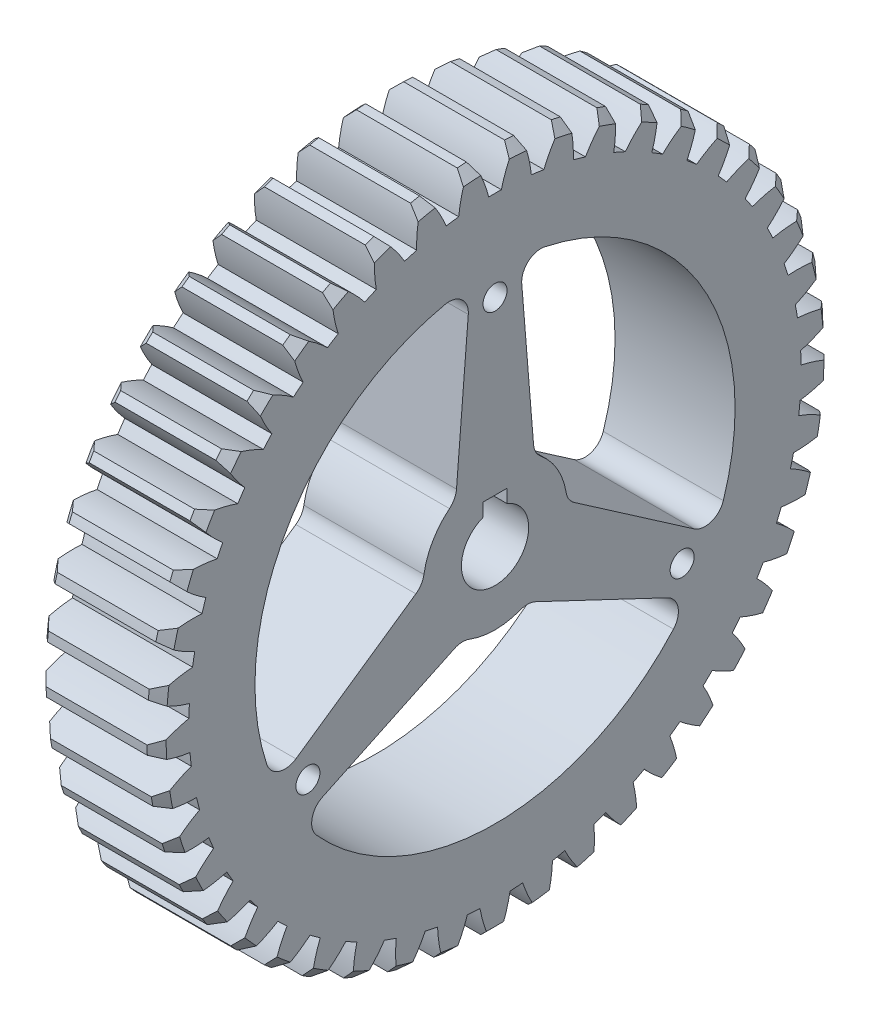
from build123d import *

# Parameters (mm, degrees)
BASPROSKE_W         = 25
BASPROSKE_H         = 70.5
CHAMFER_1_SIZE      = 2
TOOTHCUT_DEPTH      = 103.788618047
TEETHCUTS_COUNT     = 45
TEETHCUTS_ANGLE     = 352
BORSKE_R            = 7
BORE_DEPTH          = 50.0000508
KEYSKE_W            = 5
KEYSKE_H            = 9.3
KEYWAY_DEPTH        = 50.0000508
CUT_EXTRUDE_1_DEPTH = 103.777548373
SKETCH_2_R          = 2.5
CUT_EXTRUDE_2_DEPTH = 103.777548373
SKETCH_3_R          = 2
CUT_EXTRUDE_3_DEPTH = 10
FILLET_1_R          = 4


with BuildPart() as part:
    # BasProSke → Base-Revolve (revolve)
    with BuildSketch(Plane(origin=(0, 0, 0), x_dir=(1, 0, 0), z_dir=(0, 1, 0))):
        with Locations((12.5, 35.25)):
            Rectangle(BASPROSKE_W, BASPROSKE_H)
    revolve(axis=Axis((-10, 0, 0), (1, 0, 0)))

    # 倒角1
    chamfer_1_edges = [part.edges().sort_by_distance(p)[0] for p in [
        (25, 0, 70.5),
        (0, 0, 70.5),
    ]]
    chamfer(chamfer_1_edges, length=CHAMFER_1_SIZE)

    # TooCutSke → ToothCut (cut, through all)
    with BuildSketch(Plane(origin=(0, 0, 0), x_dir=(0, 0, -1), z_dir=(1, 0, 0))):
        with BuildLine():
            ThreePointArc((1.316708302, 63.735400526), (0, 63.749), (-1.316708302, 63.735400526))
            ThreePointArc((-1.316708302, 63.735400526), (-2.42575679, 67.163254741), (-3.981315359, 70.412933281))
            ThreePointArc((-3.981315359, 70.412933281), (0, 70.5254), (3.981315359, 70.412933281))
            ThreePointArc((3.981315359, 70.412933281), (2.42575679, 67.163254741), (1.316708302, 63.735400526))
        make_face()
    toothcut = extrude(amount=TOOTHCUT_DEPTH, mode=Mode.SUBTRACT)

    # TeethCuts: ToothCut ×45 about axis
    teethcuts_axis = Axis((-10, 0, 0), (1, 0, 0))
    for i in range(1, TEETHCUTS_COUNT):
        add(toothcut.rotate(teethcuts_axis, i * TEETHCUTS_ANGLE / (TEETHCUTS_COUNT - 1)), mode=Mode.SUBTRACT)

    # BorSke → Bore (cut, symmetric)
    with BuildSketch(Plane(origin=(0, 0, 0), x_dir=(0, 0, -1), z_dir=(1, 0, 0))):
        Circle(BORSKE_R)
    extrude(amount=BORE_DEPTH, both=True, mode=Mode.SUBTRACT)

    # KeySke → Keyway (cut, symmetric)
    with BuildSketch(Plane(origin=(0, 0, 0), x_dir=(0, 0, -1), z_dir=(1, 0, 0))):
        with Locations((0, 4.65)):
            Rectangle(KEYSKE_W, KEYSKE_H)
    extrude(amount=KEYWAY_DEPTH, both=True, mode=Mode.SUBTRACT)

    # 草图1 → 切除-拉伸1 (cut, through all)
    with BuildSketch(Plane(origin=(0, 0, 0), x_dir=(0, 0, -1), z_dir=(1, 0, 0))):
        with BuildLine():
            Line((-5.157087895, 49.733333333), (-8.172484063, 12.578175712))
            ThreePointArc((-8.172484063, 12.578175712), (-12.990381057, 7.5), (-14.979261731, 0.788490955))
            Line((-14.979261731, 0.788490955), (-45.648874029, -20.40049754))
            ThreePointArc((-45.648874029, -20.40049754), (-43.301270189, 25), (-5.157087895, 49.733333333))
        make_face()
        with BuildLine():
            Line((45.648874029, -20.40049754), (14.979261731, 0.788490955))
            ThreePointArc((14.979261731, 0.788490955), (12.990381057, 7.5), (8.172484063, 12.578175712))
            Line((8.172484063, 12.578175712), (5.157087895, 49.733333333))
            ThreePointArc((5.157087895, 49.733333333), (43.301270189, 25), (45.648874029, -20.40049754))
        make_face()
        with BuildLine():
            Line((-40.491786134, -29.332835793), (-6.806777668, -13.366666667))
            ThreePointArc((-6.806777668, -13.366666667), (0, -15), (6.806777668, -13.366666667))
            Line((6.806777668, -13.366666667), (40.491786134, -29.332835793))
            ThreePointArc((40.491786134, -29.332835793), (0, -50), (-40.491786134, -29.332835793))
        make_face()
    extrude(amount=CUT_EXTRUDE_1_DEPTH, mode=Mode.SUBTRACT)

    # 草图2 → 切除-拉伸2 (cut, through all)
    with BuildSketch(Plane(origin=(0, 0, 0), x_dir=(0, 0, -1), z_dir=(1, 0, 0))):
        with Locations((0, 45)):
            Circle(SKETCH_2_R)
        with Locations((38.97114317, -22.5)):
            Circle(SKETCH_2_R)
        with Locations((-38.97114317, -22.5)):
            Circle(SKETCH_2_R)
    extrude(amount=CUT_EXTRUDE_2_DEPTH, mode=Mode.SUBTRACT)

    # 草图3 → 切除-拉伸3 (cut)
    with BuildSketch(Plane(origin=(0, 0, 0), x_dir=(0, 0, -1), z_dir=(1, 0, 0))):
        with Locations((0, 30)):
            Circle(SKETCH_3_R)
        with Locations((25.980762114, -15)):
            Circle(SKETCH_3_R)
        with Locations((-25.980762114, -15)):
            Circle(SKETCH_3_R)
    extrude(amount=CUT_EXTRUDE_3_DEPTH, mode=Mode.SUBTRACT)

    # 圆角1
    fillet_1_edges = [part.edges().sort_by_distance(p)[0] for p in [
        (12.5, 12.578175712, -8.172484063),
        (12.5, 0.788490955, -14.979261731),
        (12.5, -13.366666667, -6.806777668),
        (12.5, -13.366666667, 6.806777668),
        (12.5, 0.788490955, 14.979261731),
        (12.5, 12.578175712, 8.172484063),
        (12.5, 49.733333333, 5.157087895),
        (12.5, 49.733333333, -5.157087895),
        (12.5, -20.40049754, -45.648874029),
        (12.5, -29.332835793, -40.491786134),
        (12.5, -29.332835793, 40.491786134),
        (12.5, -20.40049754, 45.648874029),
    ]]
    fillet(fillet_1_edges, radius=FILLET_1_R)


solid = part.part
